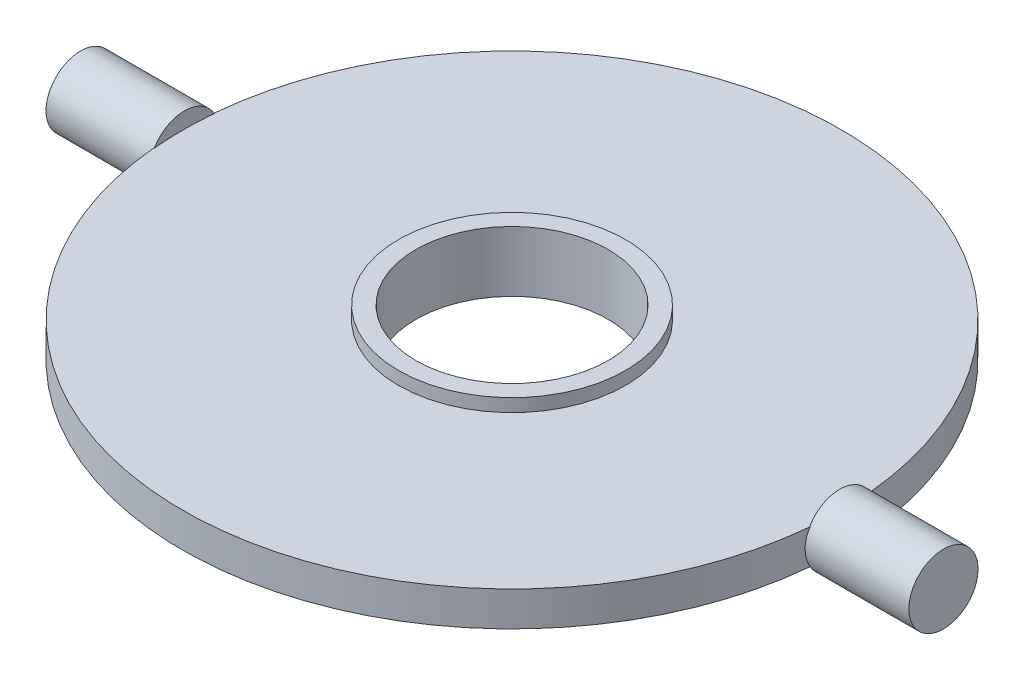
from build123d import *

# Parameters (mm, degrees)
SKETCH1_R           = 13.125
BOSS_EXTRUDE1_DEPTH = 2
SKETCH1_7_R         = 13.125
SKETCH1_7_R_2       = 11.125
BOSS_EXTRUDE2_DEPTH = 3.5


with BuildPart() as part:
    # Sketch1 → Boss-Extrude1 (new, symmetric)
    with BuildSketch(Plane(origin=(0, 0, 0), x_dir=(1, 0, 0), z_dir=(0, 1, 0))):
        with BuildLine():
            ThreePointArc((37.88944444, 4), (0, 38.1), (-37.88944444, 4))
            ThreePointArc((-37.88944444, 4), (-38.047324697, 2.002768936), (-38.1, 0))
            ThreePointArc((-38.1, 0), (-38.047324697, -2.002768936), (-37.88944444, -4))
            ThreePointArc((-37.88944444, -4), (0, -38.1), (37.88944444, -4))
            ThreePointArc((37.88944444, -4), (38.047324697, -2.002768936), (38.1, 0))
            ThreePointArc((38.1, 0), (38.047324697, 2.002768936), (37.88944444, 4))
        make_face()
        Circle(SKETCH1_R, mode=Mode.SUBTRACT)
    extrude(amount=BOSS_EXTRUDE1_DEPTH, both=True)

    # Sketch1<6> → Revolve1 (revolve)
    with BuildSketch(Plane(origin=(0, 0, 0), x_dir=(1, 0, 0), z_dir=(0, 1, 0))):
        with BuildLine():
            Line((-38.1, 0), (-49.88944444, 0))
            Line((-49.88944444, 0), (-49.88944444, -4))
            Line((-49.88944444, -4), (-37.88944444, -4))
            ThreePointArc((-37.88944444, -4), (-38.047324697, -2.002768936), (-38.1, 0))
        make_face()
        with BuildLine():
            Line((49.88944444, 0), (38.1, 0))
            ThreePointArc((38.1, 0), (38.047324697, -2.002768936), (37.88944444, -4))
            Line((37.88944444, -4), (49.88944444, -4))
            Line((49.88944444, -4), (49.88944444, 0))
        make_face()
    revolve(axis=Axis((-76.43543075, 0, 0), (1, 0, 0)))

    # Sketch1<7> → Boss-Extrude2 (add, symmetric)
    with BuildSketch(Plane(origin=(0, 0, 0), x_dir=(1, 0, 0), z_dir=(0, 1, 0))):
        Circle(SKETCH1_7_R)
        Circle(SKETCH1_7_R_2, mode=Mode.SUBTRACT)
    extrude(amount=BOSS_EXTRUDE2_DEPTH, both=True)


solid = part.part
